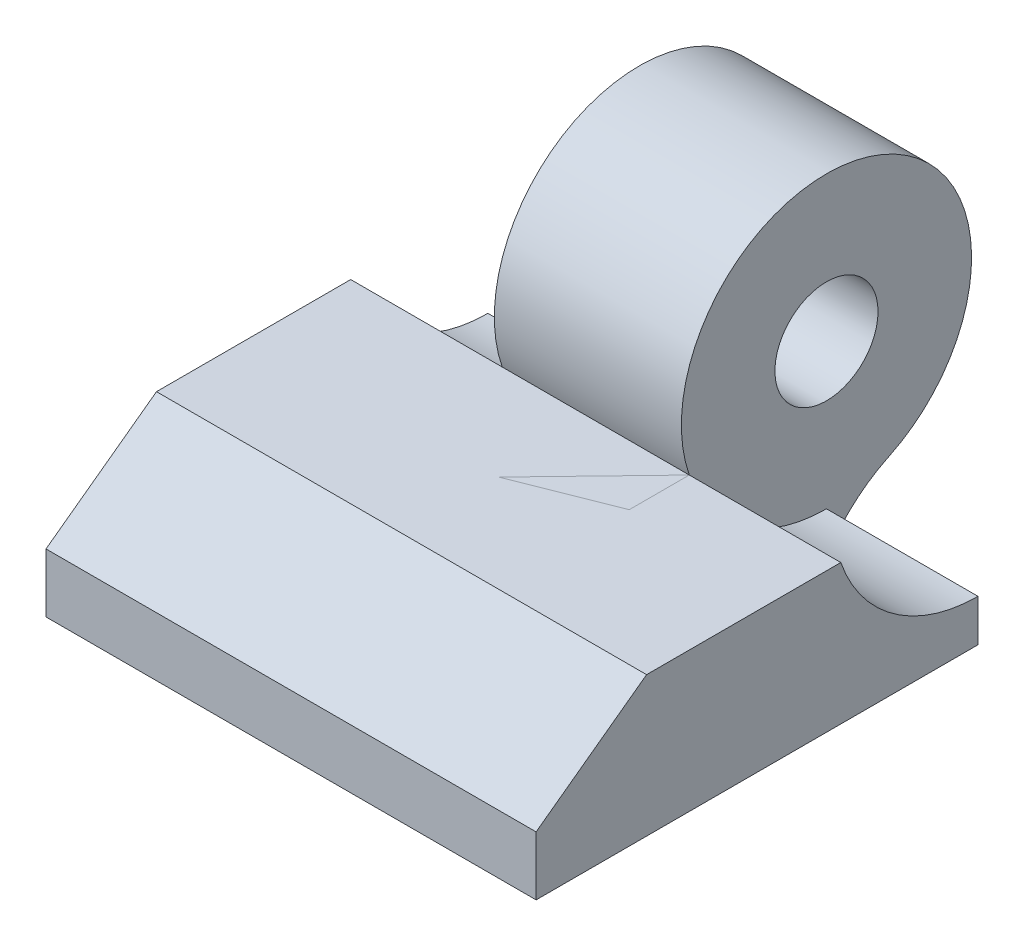
from build123d import *

# Parameters (mm, degrees)
SKETCH1_R           = 3.5
BOSS_EXTRUDE1_DEPTH = 6.35
BOSS_EXTRUDE2_DEPTH = 16.637
FILLET1_R           = 10


with BuildPart() as part:
    # Sketch1 → Boss-Extrude1 (new, symmetric)
    with BuildSketch(Plane(origin=(0, 0, 0), x_dir=(0, 0, -1), z_dir=(1, 0, 0))):
        with BuildLine():
            Line((0, -12.7), (-30, -12.7))
            Line((-30, -12.7), (-30, -8.7))
            Line((-30, -8.7), (-22.5, -3.204866216))
            Line((-22.5, -3.204866216), (-9.314039539, -3.204866216))
            ThreePointArc((-9.314039539, -3.204866216), (5.720776511, 8.018429779), (0, -9.85))
            Line((0, -9.85), (0, -12.7))
        make_face()
        Circle(SKETCH1_R, mode=Mode.SUBTRACT)
    extrude(amount=BOSS_EXTRUDE1_DEPTH, both=True)

    # Fillet1
    # the kernel refuses this fillet: 10 mm, written as the material it adds along each edge
    with BuildSketch(Plane(origin=(-6.35, -9.85, 0), x_dir=(0, -1, 0), z_dir=(1, 0, 0))) as fillet1_piece_1:
        with BuildLine():
            CenterArc((8.075688976, 8.525970603), FILLET1_R, 205.437097531, 33.058176113)
            Line((-0.954884815, 4.230771307), (-1.135496291, 4.144867321))
            ThreePointArc((-1.135496291, 4.144867321), (-0.436778957, 2.124563391), (-0.2, 0))
            Line((-0.2, 0), (0, -0.2))
            ThreePointArc((0, -0.2), (1.425, -0.2), (2.74548622, -0.170519412))
            Line((2.74548622, -0.170519412), (2.85, 0))
        make_face()
    extrude(amount=12.7)


with BuildPart() as body_2:
    # Sketch4 → Boss-Extrude2 (new, symmetric)
    with BuildSketch(Plane(origin=(0, 0, 0), x_dir=(0, 0, -1), z_dir=(1, 0, 0))):
        with BuildLine():
            Line((-30, -12.7), (0, -12.7))
            Line((0, -12.7), (0, -9.85))
            ThreePointArc((0, -9.85), (-5.720776511, -8.018429779), (-9.314039539, -3.204866216))
            Line((-9.314039539, -3.204866216), (-22.5, -3.204866216))
            Line((-22.5, -3.204866216), (-30, -8.7))
            Line((-30, -8.7), (-30, -12.7))
        make_face()
    extrude(amount=BOSS_EXTRUDE2_DEPTH, both=True)


solid = Compound([part.part, body_2.part])
